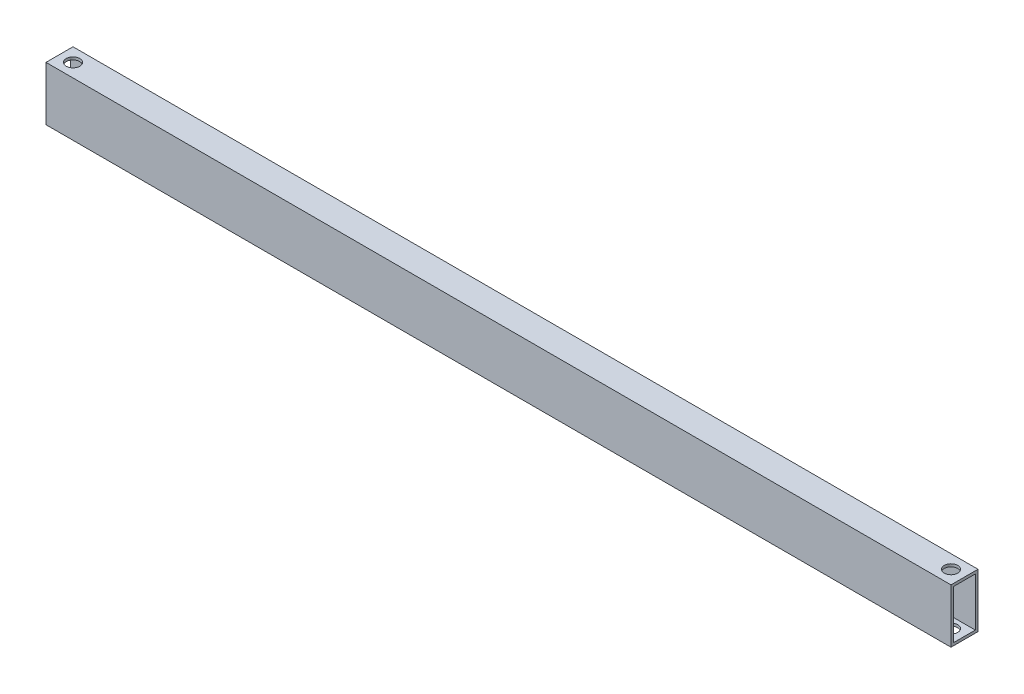
from build123d import *

# Parameters (mm, degrees)
BOSS_EXTRUDE1_DEPTH      = 225
BOSS_EXTRUDE1_DEPTH_BACK = 110
SKETCH1_W                = 10
SKETCH1_H                = 20
SKETCH1_W_2              = 8
SKETCH1_H_2              = 18
SKETCH3_R                = 2.5
CUT_EXTRUDE1_DEPTH       = 1
SKETCH4_R                = 2.5
CUT_EXTRUDE2_DEPTH       = 20


with BuildPart() as part:
    # Sketch1 → Boss-Extrude1 (new, two sides: drawn at the far end of the back side and taken through both)
    with BuildSketch(Plane(origin=(0, 0, 0), x_dir=(0, 0, -1), z_dir=(1, 0, 0)).offset(-BOSS_EXTRUDE1_DEPTH_BACK)):
        with Locations((0, 3.989361702)):
            Rectangle(SKETCH1_W, SKETCH1_H)
        with Locations((0, 3.989361702)):
            Rectangle(SKETCH1_W_2, SKETCH1_H_2, mode=Mode.SUBTRACT)
    extrude(amount=BOSS_EXTRUDE1_DEPTH + BOSS_EXTRUDE1_DEPTH_BACK)

    # Sketch3 → Cut-Extrude1 (cut)
    with BuildSketch(Plane(origin=(0, 0, -5), x_dir=(-1, 0, 0), z_dir=(0, 0, -1))):
        with Locations((-19.85, 3.989361702)):
            Circle(SKETCH3_R)
        with Locations((-10, 3.989361702)):
            Circle(SKETCH3_R)
        with Locations((0, 3.989361702)):
            Circle(SKETCH3_R)
        with Locations((10, 3.989361702)):
            Circle(SKETCH3_R)
        with Locations((19.85, 3.989361702)):
            Circle(SKETCH3_R)
    extrude(amount=-CUT_EXTRUDE1_DEPTH, mode=Mode.SUBTRACT)

    # Sketch4 → Cut-Extrude2 (cut)
    with BuildSketch(Plane(origin=(0, 13.989361702, 0), x_dir=(1, 0, 0), z_dir=(0, 1, 0))):
        with Locations((-105, 0)):
            Circle(SKETCH4_R)
        with Locations((220, 0)):
            Circle(SKETCH4_R)
    extrude(amount=-CUT_EXTRUDE2_DEPTH, mode=Mode.SUBTRACT)


solid = part.part
